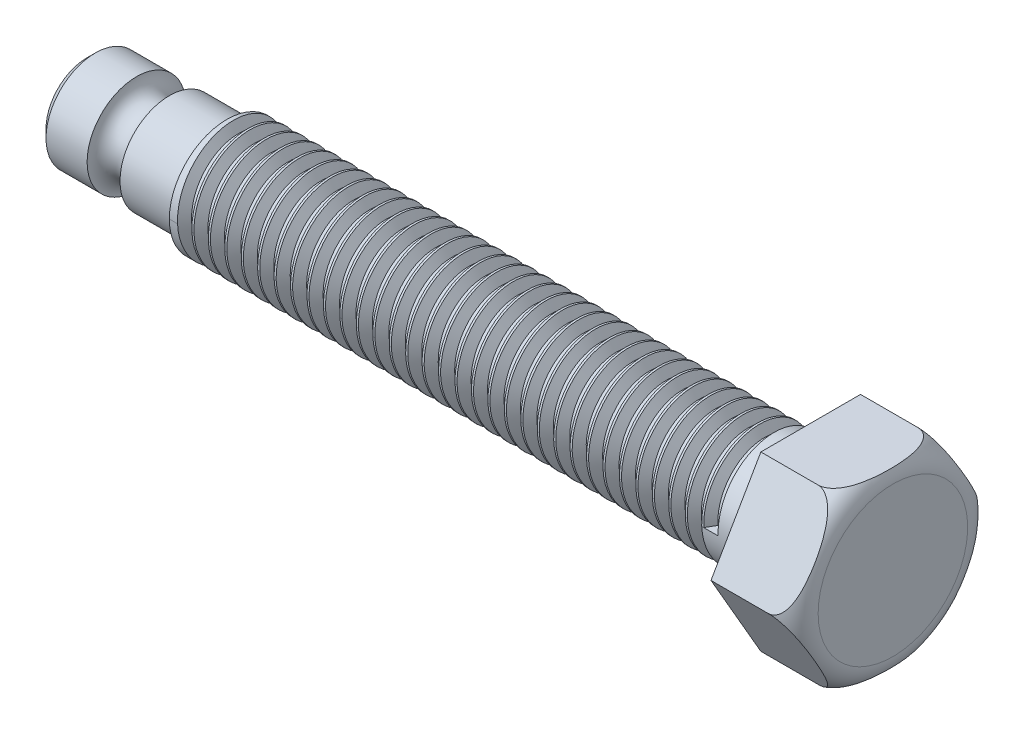
from build123d import *

# Parameters (mm, degrees)
ENL_V_START             = -10
ESQUISSE7_R             = 14
ENL_V_MAT_EXTRU_2_DEPTH = 10
FILETAGE2_PITCH         = 2
CHANFREIN3_SIZE         = 1


with BuildPart() as part:
    # Esquisse1 → Révolution2 (revolve)
    with BuildSketch(Plane.XY, mode=Mode.PRIVATE) as r_volution2_sk:
        with BuildLine():
            Line((0, 6), (0, 0))
            Line((0, 0), (98, 0))
            Line((98, 0), (98, 14))
            Line((98, 14), (88, 14))
            Line((88, 14), (88, 7))
            Line((88, 7), (17, 7))
            Line((17, 7), (17, 6))
            Line((17, 6), (10, 6))
            ThreePointArc((10, 6), (8, 4), (6, 6))
            Line((6, 6), (0, 6))
        make_face()
    revolve(r_volution2_sk.sketch.rotate(Axis((-21.538461538, 0, 0), (1, 0, 0)), 90), axis=Axis((-21.538461538, 0, 0), (1, 0, 0)))

    # Esquisse7 → Enlèv. mat.-Extru.2 (cut)
    with BuildSketch(Plane(origin=(98, 0, 0), x_dir=(0, 0, -1), z_dir=(1, 0, 0)).offset(ENL_V_START)):
        Circle(ESQUISSE7_R)
        Polygon((12.124355653, 0), (6.062177826, 10.5), (-6.062177826, 10.5), (-12.124355653, 0), (-6.062177826, -10.5), (6.062177826, -10.5), align=None, mode=Mode.SUBTRACT)
    extrude(amount=ENL_V_MAT_EXTRU_2_DEPTH, mode=Mode.SUBTRACT)

    # Esquisse11 → Enlèvement de matière-Révolution4 (revolve, cut)
    with BuildSketch(Plane(origin=(0, 0, 0), x_dir=(1, 0, 0), z_dir=(0, 1, 0)), mode=Mode.PRIVATE) as enl_vement_de_mati_re_r_volution4_sk:
        with BuildLine():
            Line((98, 12.124355653), (94.968911087, 12.124355653))
            ThreePointArc((94.968911087, 12.124355653), (97.112214612, 11.236570265), (98, 9.09326674))
            Line((98, 9.09326674), (98, 12.124355653))
        make_face()
    revolve(enl_vement_de_mati_re_r_volution4_sk.sketch.rotate(Axis((-2.507942215, 0, 0), (1, 0, 0)), 180), axis=Axis((-2.507942215, 0, 0), (1, 0, 0)), mode=Mode.SUBTRACT)

    # Filetage2: arcs per turn and ends read off the stored shape
    # Filetage2: the profile of Profil de filetage3 profile screwed along a right-hand helix through 32.5 turns, 10 arcs to a turn; built about Z, then put on its axis
    filetage2_z = Axis((0, 0, 0), (0, 0, 1))
    filetage2_corners = [(7.0003, 0, -0.000173205), (7.0003, 0, 1.7501732), (5.91746825, 0, 1.124999997), (5.91746825, 0, 0.624999997)]
    with BuildLine(mode=Mode.PRIVATE) as filetage2_profile:
        Line(filetage2_corners[0], filetage2_corners[1])
        Line(filetage2_corners[1], filetage2_corners[2])
        Line(filetage2_corners[2], filetage2_corners[3])
        Line(filetage2_corners[3], filetage2_corners[0])
    filetage2_cap = Face(filetage2_profile.wire())
    filetage2_turn_angles = [0, 18, 36, 54, 72, 90, 108, 126, 144, 162, 180, 198, 216, 234, 252, 270, 288, 306, 324, 342, 360]
    filetage2_turn_weights = [1, 0.9510565162951535, 1, 0.9510565162951535, 1, 0.9510565162951535, 1, 0.9510565162951535, 1, 0.9510565162951535, 1, 0.9510565162951535, 1, 0.9510565162951535, 1, 0.9510565162951535, 1, 0.9510565162951535, 1, 0.9510565162951535, 1]
    filetage2_turn_rails = [Edge.make_bspline([Vector(p[0], p[1], 0).rotate(filetage2_z, filetage2_turn_angles[k]) / filetage2_turn_weights[k] + Vector(0, 0, p[2] + FILETAGE2_PITCH * filetage2_turn_angles[k] / 360) for k in range(21)], [0, 0, 0, 1, 1, 2, 2, 3, 3, 4, 4, 5, 5, 6, 6, 7, 7, 8, 8, 9, 9, 10, 10, 10], 2, filetage2_turn_weights) for p in filetage2_corners]
    filetage2_turn_sides = [Face.make_surface_from_curves(filetage2_turn_rails[p[0]], filetage2_turn_rails[p[1]]) for p in [(0, 1), (1, 2), (2, 3), (3, 0)]]
    filetage2_last_angles = [11520, 11538, 11556, 11574, 11592, 11610, 11628, 11646, 11664, 11682, 11700]
    filetage2_last_weights = [1, 0.9510565162951535, 1, 0.9510565162951535, 1, 0.9510565162951535, 1, 0.9510565162951535, 1, 0.9510565162951535, 1]
    filetage2_last_rails = [Edge.make_bspline([Vector(p[0], p[1], 0).rotate(filetage2_z, filetage2_last_angles[k]) / filetage2_last_weights[k] + Vector(0, 0, p[2] + FILETAGE2_PITCH * filetage2_last_angles[k] / 360) for k in range(11)], [0, 0, 0, 1, 1, 2, 2, 3, 3, 4, 4, 5, 5, 5], 2, filetage2_last_weights) for p in filetage2_corners]
    filetage2_last_sides = [Face.make_surface_from_curves(filetage2_last_rails[p[0]], filetage2_last_rails[p[1]]) for p in [(0, 1), (1, 2), (2, 3), (3, 0)]]
    filetage2 = Plane(origin=(17, 0, 0), x_dir=(0, 0, -1), z_dir=(1, 0, 0)) * Solid(Shell([*[p.moved(Location((0, 0, FILETAGE2_PITCH * i))) for i in range(32) for p in filetage2_turn_sides], *filetage2_last_sides, filetage2_cap, filetage2_cap.rotate(filetage2_z, 11700).moved(Location((0, 0, FILETAGE2_PITCH * 11700 / 360)))]))
    add(filetage2, mode=Mode.SUBTRACT)

    # Chanfrein3
    chanfrein3_edges = [part.edges().sort_by_distance(p)[0] for p in [
        (0, 0, -6),
    ]]
    chamfer(chanfrein3_edges, length=CHANFREIN3_SIZE)


solid = part.part
